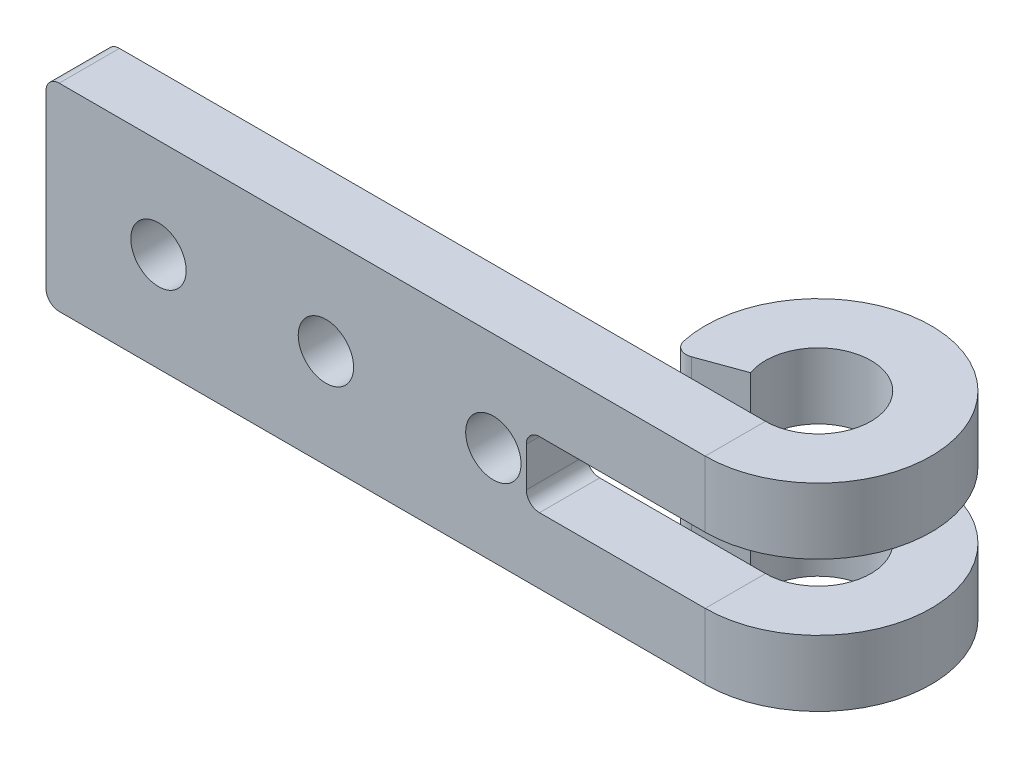
from build123d import *

# Parameters (mm, degrees)
BASE_FLANGE1_DEPTH      = 15
CUT_EXTRUDE1_DEPTH      = 14
CUT_EXTRUDE1_DEPTH_BACK = 10
SKETCH6_W               = 22.14
SKETCH6_H               = 5
FILLET1_R               = 1
SKETCH7_R               = 2.1
CUT_EXTRUDE2_DEPTH      = 10


# Sheet-metal steps are written as plain solids
with BuildPart() as part:
    # Sketch1 → Base-Flange1 (new body)
    with BuildSketch(Plane(origin=(0, 0, 0), x_dir=(1, 0, 0), z_dir=(0, 1, 0))):
        with BuildLine():
            Line((0, 0), (50, 0))
            ThreePointArc((50, 0), (52.294305745, 7.276608177), (46.241229517, 2.631919427))
            Line((46.241229517, 2.631919427), (41.94683424, 1.068887372))
            ThreePointArc((41.94683424, 1.068887372), (54.91555006, 11.02013302), (50, -4.57))
            Line((50, -4.57), (0, -4.57))
            Line((0, -4.57), (0, 0))
        make_face()
    extrude(amount=BASE_FLANGE1_DEPTH)

    # Sketch6 → Cut-Extrude1 (cut, two sides: drawn at the far end of the back side and taken through both)
    with BuildSketch(Plane(origin=(0, 0, 0), x_dir=(-1, 0, 0), z_dir=(0, 0, -1)).offset(-CUT_EXTRUDE1_DEPTH_BACK)):
        with Locations((-47.5, 7.5)):
            Rectangle(SKETCH6_W, SKETCH6_H)
    extrude(amount=CUT_EXTRUDE1_DEPTH + CUT_EXTRUDE1_DEPTH_BACK, mode=Mode.SUBTRACT)

    # Fillet1
    fillet1_edges = [part.edges().sort_by_distance(p)[0] for p in [
        (41.94683424, 12.5, -1.068887372),
        (0, 15, 2.285),
        (41.94683424, 2.5, -1.068887372),
        (36.43, 5, 2.285),
        (36.43, 10, 2.285),
        (0, 0, 2.285),
    ]]
    fillet(fillet1_edges, radius=FILLET1_R)

    # Sketch7 → Cut-Extrude2 (cut)
    with BuildSketch(Plane(origin=(0, 0, 0), x_dir=(-1, 0, 0), z_dir=(0, 0, -1))):
        with Locations((-21.23, 7.5)):
            Circle(SKETCH7_R)
        with Locations((-33.93, 7.5)):
            Circle(SKETCH7_R)
        with Locations((-8.53, 7.5)):
            Circle(SKETCH7_R)
    extrude(amount=-CUT_EXTRUDE2_DEPTH, mode=Mode.SUBTRACT)


solid = part.part
